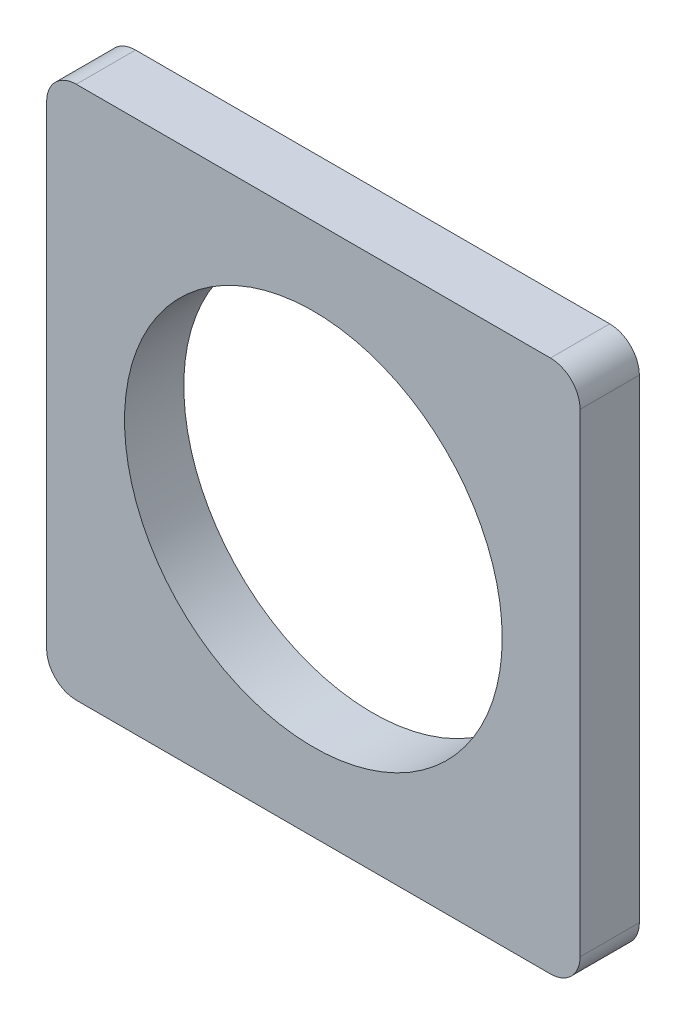
from build123d import *

# Parameters (mm, degrees)
SKETCH1_W           = 57.15
SKETCH1_H           = 57.15
SKETCH1_R           = 20.2311
BOSS_EXTRUDE1_DEPTH = 6.35
FILLET1_R           = 3.175


with BuildPart() as part:
    # Sketch1 → Boss-Extrude1 (new body)
    with BuildSketch(Plane.XY):
        with Locations((123.739144453, 1.282311101)):
            Rectangle(SKETCH1_W, SKETCH1_H)
        with Locations((123.739144453, 1.282311101)):
            Circle(SKETCH1_R, mode=Mode.SUBTRACT)
    extrude(amount=BOSS_EXTRUDE1_DEPTH)

    # Fillet1
    fillet1_edges = [part.edges().sort_by_distance(p)[0] for p in [
        (95.164144453, -27.292688899, 3.175),
        (152.314144453, -27.292688899, 3.175),
        (95.164144453, 29.857311101, 3.175),
        (152.314144453, 29.857311101, 3.175),
    ]]
    fillet(fillet1_edges, radius=FILLET1_R)


solid = part.part
